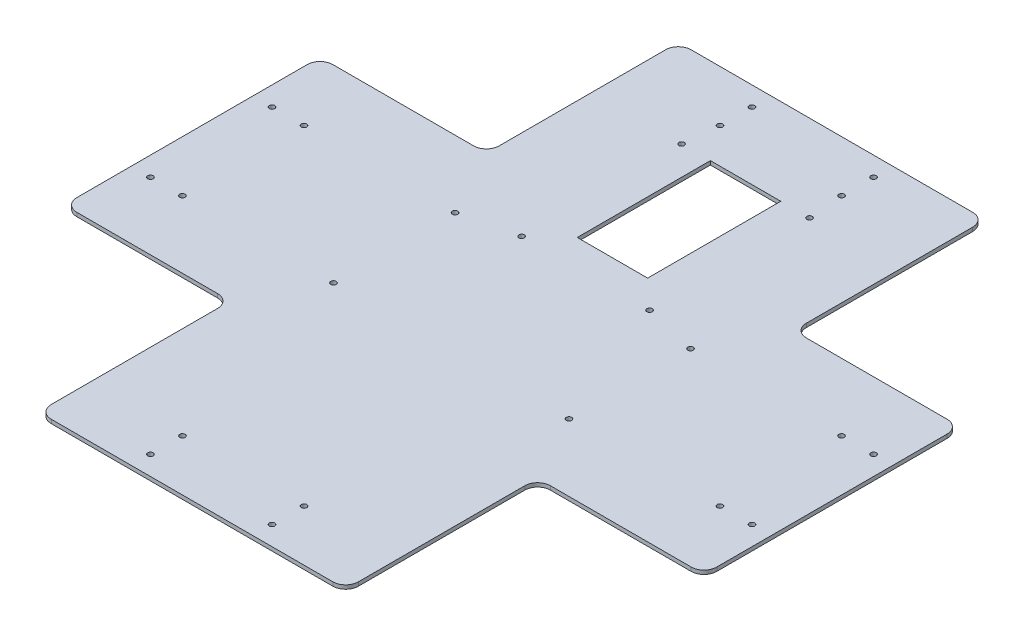
from build123d import *

# Parameters (mm, degrees)
BASE_DEPTH               = 3
FILLET1_R                = 10
SKETCH2_R                = 2.125
ARMOR_MODULE_HOLES_DEPTH = 3
SKETCH3_R                = 2.125
PLATES_FOR_GIMBAL_DEPTH  = 3
SKETCH4_R                = 2.125
SKETCH4_W                = 55
SKETCH4_H                = 104
BATTERY_MOUNT_DEPTH      = 10


with BuildPart() as part:
    # Sketch1 → Base (new body)
    with BuildSketch(Plane(origin=(0, 0, 0), x_dir=(1, 0, 0), z_dir=(0, 1, 0))):
        Polygon((120, 250), (-120, 250), (-120, 100), (-250, 100), (-250, -100), (-120, -100), (-120, -250), (120, -250), (120, -100), (250, -100), (250, 100), (120, 100), align=None)
    extrude(amount=BASE_DEPTH)

    # Fillet1
    fillet1_edges = [part.edges().sort_by_distance(p)[0] for p in [
        (120, 1.5, -100),
        (250, 1.5, -100),
        (250, 1.5, 100),
        (120, 1.5, 100),
        (120, 1.5, 250),
        (-120, 1.5, 250),
        (-120, 1.5, 100),
        (-250, 1.5, 100),
        (-250, 1.5, -100),
        (-120, 1.5, -100),
        (-120, 1.5, -250),
        (120, 1.5, -250),
    ]]
    fillet(fillet1_edges, radius=FILLET1_R)

    # Sketch2 → Armor Module Holes (cut)
    with BuildSketch(Plane(origin=(0, 3, 0), x_dir=(1, 0, 0), z_dir=(0, 1, 0))):
        with Locations((-47.5, 235)):
            Circle(SKETCH2_R)
        with Locations((-47.5, 210)):
            Circle(SKETCH2_R)
        with Locations((-235, 47.5)):
            Circle(SKETCH2_R)
        with Locations((-210, 47.5)):
            Circle(SKETCH2_R)
        with Locations((-210, -47.5)):
            Circle(SKETCH2_R)
        with Locations((-235, -47.5)):
            Circle(SKETCH2_R)
        with Locations((235, -47.5)):
            Circle(SKETCH2_R)
        with Locations((210, -47.5)):
            Circle(SKETCH2_R)
        with Locations((210, 47.5)):
            Circle(SKETCH2_R)
        with Locations((235, 47.5)):
            Circle(SKETCH2_R)
        with Locations((47.5, 210)):
            Circle(SKETCH2_R)
        with Locations((47.5, 235)):
            Circle(SKETCH2_R)
        with Locations((47.5, -235)):
            Circle(SKETCH2_R)
        with Locations((47.5, -210)):
            Circle(SKETCH2_R)
        with Locations((-47.5, -210)):
            Circle(SKETCH2_R)
        with Locations((-47.5, -235)):
            Circle(SKETCH2_R)
    extrude(amount=-ARMOR_MODULE_HOLES_DEPTH, mode=Mode.SUBTRACT)

    # Sketch3 → Plates for Gimbal (cut)
    with BuildSketch(Plane(origin=(0, 3, 0), x_dir=(1, 0, 0), z_dir=(0, 1, 0))):
        with Locations((92, 47.5)):
            Circle(SKETCH3_R)
        with Locations((92, -47.5)):
            Circle(SKETCH3_R)
        with Locations((-92, -47.5)):
            Circle(SKETCH3_R)
        with Locations((-92, 47.5)):
            Circle(SKETCH3_R)
    extrude(amount=-PLATES_FOR_GIMBAL_DEPTH, mode=Mode.SUBTRACT)

    # Sketch4 → Battery Mount (cut)
    with BuildSketch(Plane(origin=(0, 3, 0), x_dir=(1, 0, 0), z_dir=(0, 1, 0))):
        with Locations((-50, 182.5)):
            Circle(SKETCH4_R)
        with Locations((50, 182.5)):
            Circle(SKETCH4_R)
        with Locations((50, 57.5)):
            Circle(SKETCH4_R)
        with Locations((-50, 57.5)):
            Circle(SKETCH4_R)
        with Locations((0, 130.5)):
            Rectangle(SKETCH4_W, SKETCH4_H)
    extrude(amount=-BATTERY_MOUNT_DEPTH, mode=Mode.SUBTRACT)


solid = part.part
